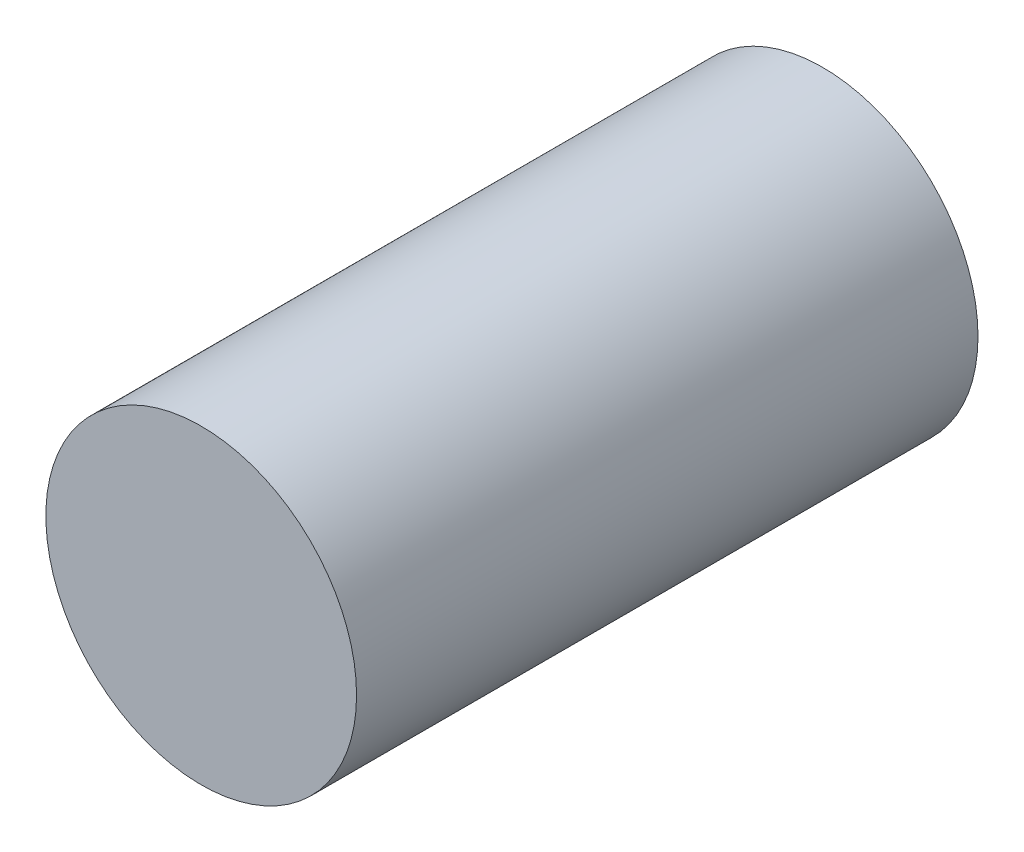
from build123d import *

# Parameters (mm, degrees)
SKETCH1_R           = 2.5
BOSS_EXTRUDE1_DEPTH = 10


with BuildPart() as part:
    # Sketch1 → Boss-Extrude1 (new body)
    with BuildSketch(Plane.XY):
        Circle(SKETCH1_R)
    extrude(amount=BOSS_EXTRUDE1_DEPTH)


solid = part.part
